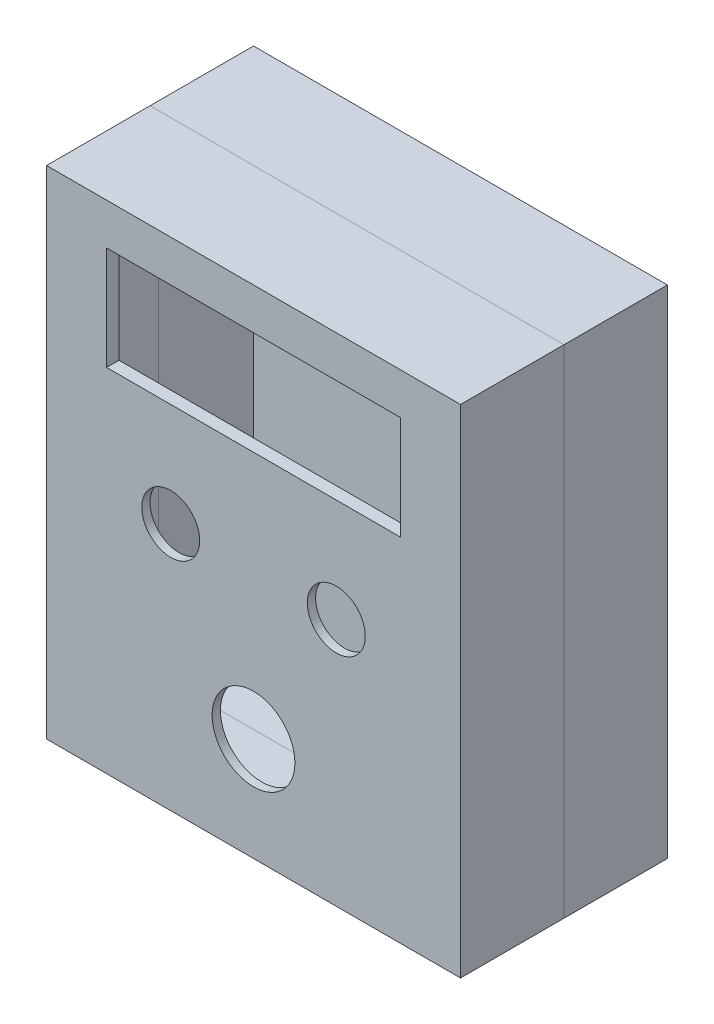
from build123d import *

# Parameters (mm, degrees)
SKETCH1_W            = 50
SKETCH1_H            = 120
BOSS_EXTRUDE1_DEPTH  = 100
SKETCH2_W            = 71
SKETCH2_H            = 25
CUT_EXTRUDE1_DEPTH   = 3
SHELL1_START         = -23
SHELL1_OUTLINE_W     = 96
SHELL1_OUTLINE_H     = 116
SHELL1_DEPTH         = 45
SHELL1_START_2       = 22
SHELL1_2_OUTLINE_W   = 96
SHELL1_2_OUTLINE_H   = 116
SHELL1_2_OUTLINE_W_2 = 75
SHELL1_2_OUTLINE_H_2 = 29
SHELL1_2_DEPTH       = 1
SKETCH3_W            = 80
SKETCH3_H            = 10
CUT_EXTRUDE2_DEPTH   = 3
SKETCH4_R            = 10
CUT_EXTRUDE3_DEPTH   = 3
SKETCH5_R            = 7
CUT_EXTRUDE4_DEPTH   = 3


# Read off the part's stored shape, not the designer's step: Shell1
with BuildPart() as part:
    # Sketch1 → Boss-Extrude1 (new body)
    with BuildSketch(Plane(origin=(0, 0, 0), x_dir=(0, 0, -1), z_dir=(1, 0, 0))):
        Rectangle(SKETCH1_W, SKETCH1_H)
    extrude(amount=BOSS_EXTRUDE1_DEPTH)

    # Sketch2 → Cut-Extrude1 (cut)
    with BuildSketch(Plane.XY.offset(25)):
        with Locations((50, 37.5)):
            Rectangle(SKETCH2_W, SKETCH2_H)
    extrude(amount=-CUT_EXTRUDE1_DEPTH, mode=Mode.SUBTRACT)

    # Shell1 outline → Shell1 (cut)
    with BuildSketch(Plane.XY.offset(SHELL1_START)):
        with Locations((50, 0)):
            Rectangle(SHELL1_OUTLINE_W, SHELL1_OUTLINE_H)
    extrude(amount=SHELL1_DEPTH, mode=Mode.SUBTRACT)

    # Shell1 2 outline → Shell1 2 (cut)
    with BuildSketch(Plane.XY.offset(SHELL1_START_2)):
        with Locations((50, 0)):
            Rectangle(SHELL1_2_OUTLINE_W, SHELL1_2_OUTLINE_H)
        with Locations((50, 37.5)):
            Rectangle(SHELL1_2_OUTLINE_W_2, SHELL1_2_OUTLINE_H_2, mode=Mode.SUBTRACT)
    extrude(amount=SHELL1_2_DEPTH, mode=Mode.SUBTRACT)

    # Sketch3 → Cut-Extrude2 (cut)
    with BuildSketch(Plane.XZ.offset(60)):
        with Locations((50, -16)):
            Rectangle(SKETCH3_W, SKETCH3_H)
    extrude(amount=-CUT_EXTRUDE2_DEPTH, mode=Mode.SUBTRACT)

    # Sketch4 → Cut-Extrude3 (cut)
    with BuildSketch(Plane.XY.offset(25)):
        with Locations((50, -35)):
            Circle(SKETCH4_R)
    extrude(amount=-CUT_EXTRUDE3_DEPTH, mode=Mode.SUBTRACT)

    # Sketch5 → Cut-Extrude4 (cut)
    with BuildSketch(Plane.XY.offset(25)):
        with Locations((30, 0)):
            Circle(SKETCH5_R)
        with Locations(Location((70, 0, 0), (0, 0, 180))):
            Circle(SKETCH5_R)
    extrude(amount=-CUT_EXTRUDE4_DEPTH, mode=Mode.SUBTRACT)


with BuildPart() as body_2:
    # Split1: the piece on the far side of the plane
    add(part.part)
    split(bisect_by=Plane.XY, keep=Keep.BOTTOM)


with BuildPart() as part_1:
    add(part.part)

    # Split1
    split(bisect_by=Plane.XY, keep=Keep.TOP)


solid = Compound([body_2.part, part_1.part])
